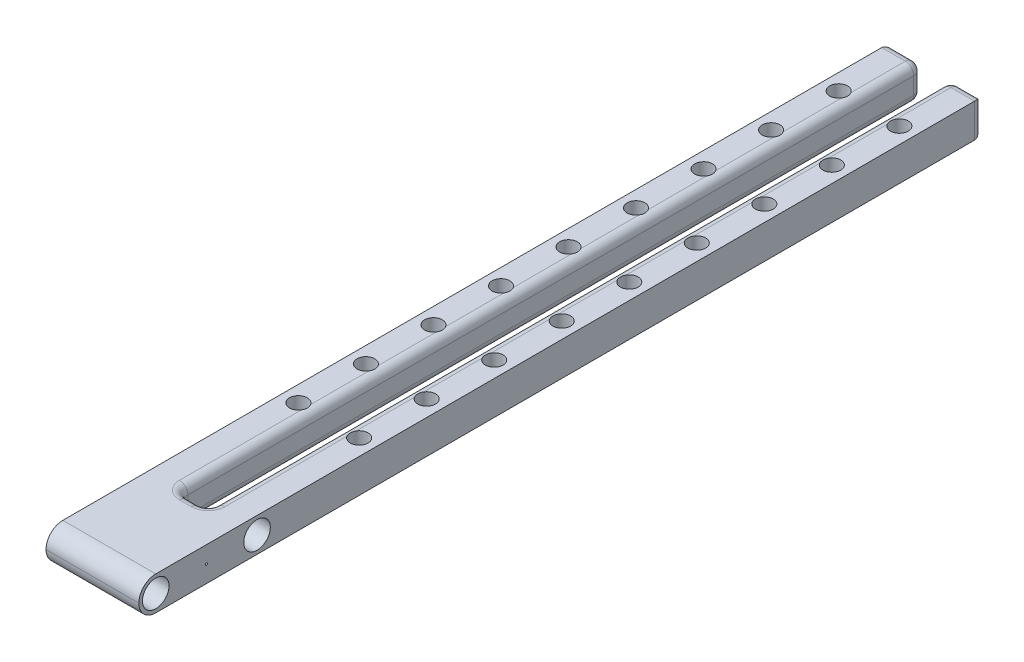
from build123d import *

# Parameters (mm, degrees)
SKETCH1_R           = 2.1
BOSS_EXTRUDE1_DEPTH = 8
SKETCH2_R           = 3.15
CUT_EXTRUDE1_DEPTH  = 4.7
CUT_EXTRUDE2_START  = -4.7
SKETCH3_R           = 3.15
SKETCH3_R_2         = 0.25
CUT_EXTRUDE2_DEPTH  = 4.7
FILLET1_R           = 4
FILLET2_R           = 2


# Some blends are built 0.0001 mm under size
with BuildPart() as part:
    # Sketch1 → Boss-Extrude1 (new body)
    with BuildSketch(Plane(origin=(0, 0, 0), x_dir=(1, 0, 0), z_dir=(0, 1, 0))):
        Polygon((0, 0), (22, 0), (22, 200), (14.4, 200), (14.4, 24), (7.6, 24), (7.6, 200), (0, 200), align=None)
        with Locations(Location((3.8, 184, 0), (0, 0, 270))):
            Circle(SKETCH1_R, mode=Mode.SUBTRACT)
        with Locations(Location((18.2, 184, 0), (0, 0, 270))):
            Circle(SKETCH1_R, mode=Mode.SUBTRACT)
        with Locations(Location((3.8, 168, 0), (0, 0, 270))):
            Circle(SKETCH1_R, mode=Mode.SUBTRACT)
        with Locations(Location((18.2, 168, 0), (0, 0, 270))):
            Circle(SKETCH1_R, mode=Mode.SUBTRACT)
        with Locations(Location((3.8, 152, 0), (0, 0, 270))):
            Circle(SKETCH1_R, mode=Mode.SUBTRACT)
        with Locations(Location((18.2, 152, 0), (0, 0, 270))):
            Circle(SKETCH1_R, mode=Mode.SUBTRACT)
        with Locations(Location((3.8, 136, 0), (0, 0, 270))):
            Circle(SKETCH1_R, mode=Mode.SUBTRACT)
        with Locations(Location((18.2, 136, 0), (0, 0, 270))):
            Circle(SKETCH1_R, mode=Mode.SUBTRACT)
        with Locations(Location((3.8, 120, 0), (0, 0, 270))):
            Circle(SKETCH1_R, mode=Mode.SUBTRACT)
        with Locations(Location((18.2, 120, 0), (0, 0, 270))):
            Circle(SKETCH1_R, mode=Mode.SUBTRACT)
        with Locations(Location((3.8, 104, 0), (0, 0, 270))):
            Circle(SKETCH1_R, mode=Mode.SUBTRACT)
        with Locations(Location((18.2, 104, 0), (0, 0, 270))):
            Circle(SKETCH1_R, mode=Mode.SUBTRACT)
        with Locations(Location((3.8, 88, 0), (0, 0, 270))):
            Circle(SKETCH1_R, mode=Mode.SUBTRACT)
        with Locations(Location((18.2, 88, 0), (0, 0, 270))):
            Circle(SKETCH1_R, mode=Mode.SUBTRACT)
        with Locations(Location((3.8, 72, 0), (0, 0, 270))):
            Circle(SKETCH1_R, mode=Mode.SUBTRACT)
        with Locations(Location((18.2, 72, 0), (0, 0, 270))):
            Circle(SKETCH1_R, mode=Mode.SUBTRACT)
        with Locations(Location((3.8, 56, 0), (0, 0, 270))):
            Circle(SKETCH1_R, mode=Mode.SUBTRACT)
        with Locations(Location((18.2, 56, 0), (0, 0, 270))):
            Circle(SKETCH1_R, mode=Mode.SUBTRACT)
    extrude(amount=BOSS_EXTRUDE1_DEPTH)

    # Sketch2 → Cut-Extrude1 (cut)
    with BuildSketch(Plane.ZY):
        with Locations((-28, 4)):
            Circle(SKETCH2_R)
        with Locations((-4, 4)):
            Circle(SKETCH2_R)
    extrude(amount=-CUT_EXTRUDE1_DEPTH, mode=Mode.SUBTRACT)

    # Sketch3 → Cut-Extrude2 (cut)
    with BuildSketch(Plane(origin=(22, 0, 0), x_dir=(0, 0, -1), z_dir=(1, 0, 0)).offset(CUT_EXTRUDE2_START)):
        with Locations(Location((4, 4, 0), (0, 0, 180))):
            Circle(SKETCH3_R)
        with Locations(Location((28, 4, 0), (0, 0, 180))):
            Circle(SKETCH3_R)
        with Locations((16, 4)):
            Circle(SKETCH3_R_2)
    extrude(amount=CUT_EXTRUDE2_DEPTH, mode=Mode.SUBTRACT)

    # Fillet1
    fillet1_edges = [part.edges().sort_by_distance(p)[0] for p in [
        (11, 0, 0),
        (11, 8, 0),
    ]]
    fillet(fillet1_edges, radius=FILLET1_R - 0.0001)  # a hair under: the kernel refuses the full size

    # Fillet2
    # the kernel refuses this fillet: 2 mm, written as the material it adds along each edge
    with BuildSketch(Plane(origin=(7.6, 0, -24), x_dir=(1, 0, 0), z_dir=(0, 1, 0)), Plane(origin=(14.4, 0, -24), x_dir=(0, 0, -1), z_dir=(0, 1, 0))) as fillet2_piece_1:
        with BuildLine():
            CenterArc((FILLET2_R, FILLET2_R), FILLET2_R, 180, 90)
            Line((0, FILLET2_R), (0, 0))
            Line((0, 0), (FILLET2_R, 0))
        make_face()
    extrude(amount=8)
    # the kernel refuses this fillet: 2 mm, written as the material it takes off along each edge
    with BuildSketch(Plane(origin=(27, 0, -200), x_dir=(0, 0, 1), z_dir=(-1, 0, 0)), Plane(origin=(12.6, 8, -200), x_dir=(0, -1, 0), z_dir=(-1, 0, 0)), Plane(origin=(12.6, 0, -200), x_dir=(0, 0, 1), z_dir=(-1, 0, 0))) as fillet2_2_piece_1:
        with BuildLine():
            CenterArc((FILLET2_R, FILLET2_R), FILLET2_R, 180, 90)
            Line((0, FILLET2_R), (0, 0))
            Line((0, 0), (FILLET2_R, 0))
        make_face()
    extrude(amount=17.6, mode=Mode.SUBTRACT)
    with BuildSketch(Plane(origin=(0, -5, -200), x_dir=(0, 0, 1), z_dir=(0, 1, 0)), Plane(origin=(7.6, -5, -200), x_dir=(-1, 0, 0), z_dir=(0, 1, 0))) as fillet2_2_piece_2:
        with BuildLine():
            CenterArc((FILLET2_R, FILLET2_R), FILLET2_R, 180, 90)
            Line((0, FILLET2_R), (0, 0))
            Line((0, 0), (FILLET2_R, 0))
        make_face()
    extrude(amount=18, mode=Mode.SUBTRACT)
    with BuildSketch(Plane(origin=(14.4, -5, -200), x_dir=(1, 0, 0), z_dir=(0, 1, 0)), Plane(origin=(22, -5, -200), x_dir=(0, 0, 1), z_dir=(0, 1, 0))) as fillet2_2_piece_3:
        with BuildLine():
            CenterArc((FILLET2_R, -FILLET2_R), FILLET2_R, 90, 90)
            Line((0, -FILLET2_R), (0, 0))
            Line((0, 0), (FILLET2_R, 0))
        make_face()
    extrude(amount=18, mode=Mode.SUBTRACT)
    with BuildSketch(Plane(origin=(27, 8, -200), x_dir=(0, 0, 1), z_dir=(-1, 0, 0))) as fillet2_2_piece_4:
        with BuildLine():
            CenterArc((FILLET2_R, -FILLET2_R), FILLET2_R, 90, 90)
            Line((0, -FILLET2_R), (0, 0))
            Line((0, 0), (FILLET2_R, 0))
        make_face()
    extrude(amount=17.6, mode=Mode.SUBTRACT)
    # the kernel refuses this fillet: 2 mm, written as the material it takes off along each edge
    with BuildSketch(Plane(origin=(16.4, 2, -198), x_dir=(-1, 0, 0), z_dir=(0, -1, 0))) as fillet2_3_piece_1_section:
        Polygon((0, 0), (FILLET2_R, 0), (FILLET2_R, FILLET2_R), (0, FILLET2_R), align=None)
    fillet2_3_piece_1 = extrude(amount=FILLET2_R, mode=Mode.PRIVATE)
    fillet2_3_piece_1 = fillet2_3_piece_1 - Plane(origin=(16.4, 2, -198), x_dir=(0.7071067811865488, 0, 0.707106781186546), z_dir=(0, -1, 0)) * Sphere(FILLET2_R, mode=Mode.PRIVATE)
    add(fillet2_3_piece_1, mode=Mode.SUBTRACT)
    with BuildSketch(Plane(origin=(5.6, 2, -198), x_dir=(1, 0, 0), z_dir=(0, -1, 0))) as fillet2_3_piece_2_section:
        Polygon((0, 0), (FILLET2_R, 0), (FILLET2_R, -FILLET2_R), (0, -FILLET2_R), align=None)
    fillet2_3_piece_2 = extrude(amount=FILLET2_R, mode=Mode.PRIVATE)
    fillet2_3_piece_2 = fillet2_3_piece_2 - Plane(origin=(5.6, 2, -198), x_dir=(-0.7071067811865475, 0, 0.7071067811865475), z_dir=(0, -1, 0)) * Sphere(FILLET2_R, mode=Mode.PRIVATE)
    add(fillet2_3_piece_2, mode=Mode.SUBTRACT)
    with BuildSketch(Plane(origin=(5.6, 6, -198), x_dir=(1, 0, 0), z_dir=(0, 1, 0))) as fillet2_3_piece_3_section:
        Polygon((0, 0), (FILLET2_R, 0), (FILLET2_R, FILLET2_R), (0, FILLET2_R), align=None)
    fillet2_3_piece_3 = extrude(amount=FILLET2_R, mode=Mode.PRIVATE)
    fillet2_3_piece_3 = fillet2_3_piece_3 - Plane(origin=(5.6, 6, -198), x_dir=(-0.7071067811865475, 0, 0.7071067811865475), z_dir=(0, 1, 0)) * Sphere(FILLET2_R, mode=Mode.PRIVATE)
    add(fillet2_3_piece_3, mode=Mode.SUBTRACT)
    with BuildSketch(Plane(origin=(16.4, 6, -198), x_dir=(-1, 0, 0), z_dir=(0, 1, 0))) as fillet2_3_piece_4_section:
        Polygon((0, 0), (FILLET2_R, 0), (FILLET2_R, -FILLET2_R), (0, -FILLET2_R), align=None)
    fillet2_3_piece_4 = extrude(amount=FILLET2_R, mode=Mode.PRIVATE)
    fillet2_3_piece_4 = fillet2_3_piece_4 - Plane(origin=(16.4, 6, -198), x_dir=(0.7071067811865488, 0, 0.707106781186546), z_dir=(0, 1, 0)) * Sphere(FILLET2_R, mode=Mode.PRIVATE)
    add(fillet2_3_piece_4, mode=Mode.SUBTRACT)
    with BuildSketch(Plane(origin=(14.4, 8, -198), x_dir=(1, 0, 0), z_dir=(0, 0, 1)), Plane(origin=(7.6, 8, -26), x_dir=(-1, 0, 0), z_dir=(0, 0, -1))) as fillet2_3_piece_5:
        with BuildLine():
            CenterArc((FILLET2_R, -FILLET2_R), FILLET2_R, 90, 90)
            Line((0, -FILLET2_R), (0, 0))
            Line((0, 0), (FILLET2_R, 0))
        make_face()
    extrude(amount=172, mode=Mode.SUBTRACT)
    with BuildSketch(Plane(origin=(12.4, 8, -24), x_dir=(0, 0, 1), z_dir=(-1, 0, 0))) as fillet2_3_piece_6:
        with BuildLine():
            CenterArc((FILLET2_R, -FILLET2_R), FILLET2_R, 90, 90)
            Line((0, -FILLET2_R), (0, 0))
            Line((0, 0), (FILLET2_R, 0))
        make_face()
    extrude(amount=2.8, mode=Mode.SUBTRACT)
    with BuildSketch(Plane(origin=(7.6, 0, -26), x_dir=(-1, 0, 0), z_dir=(0, 0, -1)), Plane(origin=(14.4, 0, -198), x_dir=(1, 0, 0), z_dir=(0, 0, 1))) as fillet2_3_piece_7:
        with BuildLine():
            CenterArc((FILLET2_R, FILLET2_R), FILLET2_R, 180, 90)
            Line((0, FILLET2_R), (0, 0))
            Line((0, 0), (FILLET2_R, 0))
        make_face()
    extrude(amount=172, mode=Mode.SUBTRACT)
    with BuildSketch(Plane(origin=(12.4, 0, -24), x_dir=(0, 0, 1), z_dir=(-1, 0, 0))) as fillet2_3_piece_8:
        with BuildLine():
            CenterArc((FILLET2_R, FILLET2_R), FILLET2_R, 180, 90)
            Line((0, FILLET2_R), (0, 0))
            Line((0, 0), (FILLET2_R, 0))
        make_face()
    extrude(amount=2.8, mode=Mode.SUBTRACT)
    with BuildSketch(Plane(origin=(12.4, 0, -26), x_dir=(1, 0, 0), z_dir=(0, 0, -1))) as fillet2_3_piece_9:
        with BuildLine():
            CenterArc((2 + FILLET2_R, -FILLET2_R), FILLET2_R, 90, 90)
            Line((2, -FILLET2_R), (2, 0))
            Line((2, 0), (2 + FILLET2_R, 0))
        make_face()
    revolve(axis=Axis((12.4, 0, -26), (0, -1, 0)), revolution_arc=90, mode=Mode.SUBTRACT)
    with BuildSketch(Plane(origin=(9.6, 0, -26), x_dir=(0, 0, 1), z_dir=(1, 0, 0))) as fillet2_3_piece_10:
        with BuildLine():
            CenterArc((2 + FILLET2_R, -FILLET2_R), FILLET2_R, 90, 90)
            Line((2, -FILLET2_R), (2, 0))
            Line((2, 0), (2 + FILLET2_R, 0))
        make_face()
    revolve(axis=Axis((9.6, 0, -26), (0, -1, 0)), revolution_arc=90, mode=Mode.SUBTRACT)
    with BuildSketch(Plane(origin=(9.6, 8, -26), x_dir=(0, 0, 1), z_dir=(1, 0, 0))) as fillet2_3_piece_11:
        with BuildLine():
            CenterArc((2 + FILLET2_R, FILLET2_R), FILLET2_R, 180, 90)
            Line((2, FILLET2_R), (2, 0))
            Line((2, 0), (2 + FILLET2_R, 0))
        make_face()
    revolve(axis=Axis((9.6, 8, -26), (0, -1, 0)), revolution_arc=90, mode=Mode.SUBTRACT)
    with BuildSketch(Plane(origin=(12.4, 8, -26), x_dir=(1, 0, 0), z_dir=(0, 0, -1))) as fillet2_3_piece_12:
        with BuildLine():
            CenterArc((2 + FILLET2_R, FILLET2_R), FILLET2_R, 180, 90)
            Line((2, FILLET2_R), (2, 0))
            Line((2, 0), (2 + FILLET2_R, 0))
        make_face()
    revolve(axis=Axis((12.4, 8, -26), (0, -1, 0)), revolution_arc=90, mode=Mode.SUBTRACT)


solid = part.part
